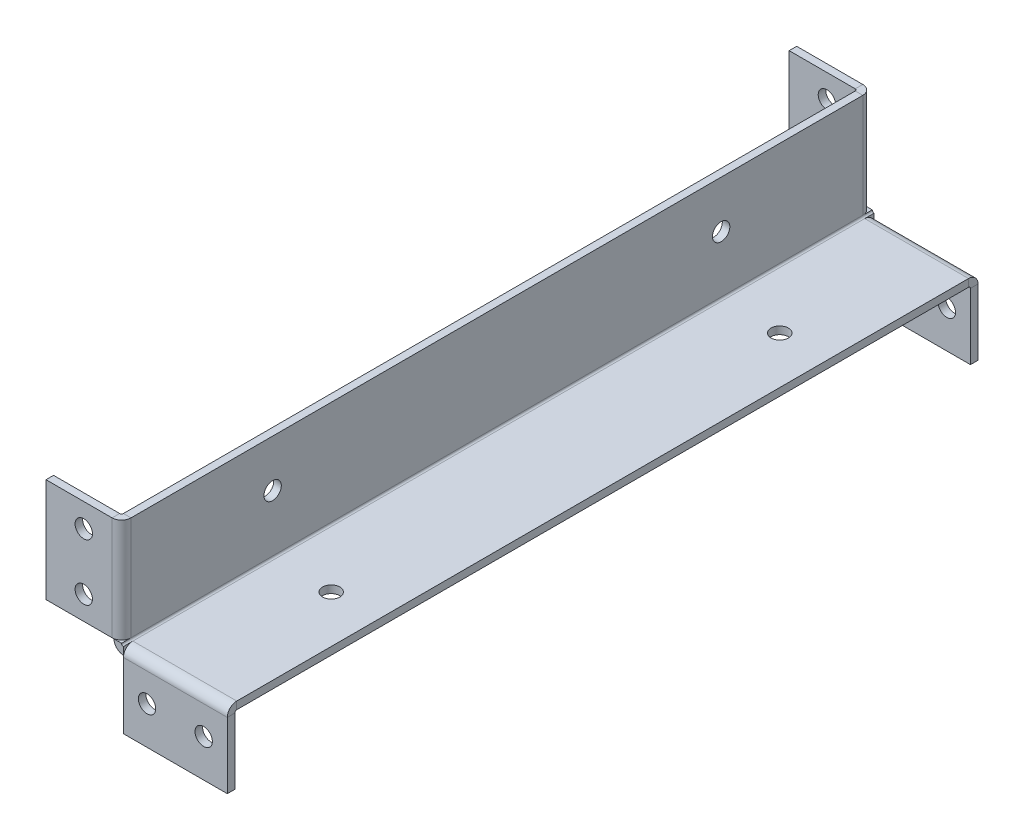
from build123d import *

# Parameters (mm, degrees)
SKETCH1_W                      = 60
SKETCH1_H                      = 397.5
BASE_FLANGE1_DEPTH             = 4
EDGE_FLANGE1_STRIP_W           = 18
EDGE_FLANGE1_STRIP_H           = 4
EDGE_FLANGE1_STRIP_CUT_DEPTH   = 397.5
EDGE_FLANGE1_DEPTH             = 397.5
EDGE_FLANGE2_STRIP_W           = 18
EDGE_FLANGE2_STRIP_H           = 4
EDGE_FLANGE2_STRIP_CUT_DEPTH   = 55
EDGE_FLANGE2_STRIP_2_W         = 18
EDGE_FLANGE2_STRIP_2_H         = 4
EDGE_FLANGE2_STRIP_CUT_2_DEPTH = 55
EDGE_FLANGE2_STRIP_3_W         = 18
EDGE_FLANGE2_STRIP_3_H         = 4
EDGE_FLANGE2_STRIP_CUT_3_DEPTH = 55
EDGE_FLANGE2_STRIP_4_W         = 18
EDGE_FLANGE2_STRIP_4_H         = 4
EDGE_FLANGE2_STRIP_CUT_4_DEPTH = 55
EDGE_FLANGE2_DEPTH             = 55
EDGE_FLANGE2_BEND_DEPTH        = 55
EDGE_FLANGE2_BEND_2_DEPTH      = 55
EDGE_FLANGE2_BEND_3_DEPTH      = 55
SKETCH18_R                     = 4.6
EXTRUDE1_DEPTH                 = 408.38464625
SKETCH19_R                     = 4.6
EXTRUDE2_DEPTH                 = 4
SKETCH20_R                     = 4.6
EXTRUDE3_DEPTH                 = 4


# Sheet-metal steps are written as plain solids
with BuildPart() as part:
    # Sketch1 → Base-Flange1 (new body)
    with BuildSketch(Plane(origin=(0, 0, 0), x_dir=(1, 0, 0), z_dir=(0, 1, 0))):
        Rectangle(SKETCH1_W, SKETCH1_H)
    extrude(amount=BASE_FLANGE1_DEPTH)

    # Edge-Flange1 strip (across the edge) → Edge-Flange1 strip cut (cut)
    with BuildSketch(Plane(origin=(-30, 4, -198.75), x_dir=(1, 0, 0), z_dir=(0, 0, 1))):
        with Locations((-4, -2)):
            Rectangle(EDGE_FLANGE1_STRIP_W, EDGE_FLANGE1_STRIP_H)
    extrude(amount=EDGE_FLANGE1_STRIP_CUT_DEPTH, mode=Mode.SUBTRACT)

    # Edge-Flange1 section (across the edge) → Edge-Flange1 (add)
    with BuildSketch(Plane(origin=(-30, 4, -198.75), x_dir=(1, 0, 0), z_dir=(0, 0, 1))):
        with BuildLine():
            Line((0, 1), (0, 56))
            Line((0, 56), (4, 56))
            Line((4, 56), (4, 1))
            ThreePointArc((4, 1), (4.292893219, 0.292893219), (5, 0))
            Line((5, 0), (5, -4))
            ThreePointArc((5, -4), (1.464466094, -2.535533906), (0, 1))
        make_face()
    extrude(amount=EDGE_FLANGE1_DEPTH)

    # Edge-Flange2 strip (across the edge) → Edge-Flange2 strip cut (cut)
    with BuildSketch(Plane(origin=(-30, 5, 198.75), x_dir=(0, 0, -1), z_dir=(0, 1, 0))):
        with Locations((-4, -2)):
            Rectangle(EDGE_FLANGE2_STRIP_W, EDGE_FLANGE2_STRIP_H)
    extrude(amount=EDGE_FLANGE2_STRIP_CUT_DEPTH, mode=Mode.SUBTRACT)

    # Edge-Flange2 strip 2 (across the edge) → Edge-Flange2 strip cut 2 (cut)
    with BuildSketch(Plane(origin=(30, 0, 198.75), x_dir=(0, 0, -1), z_dir=(-1, 0, 0))):
        with Locations((-4, -2)):
            Rectangle(EDGE_FLANGE2_STRIP_2_W, EDGE_FLANGE2_STRIP_2_H)
    extrude(amount=EDGE_FLANGE2_STRIP_CUT_2_DEPTH, mode=Mode.SUBTRACT)

    # Edge-Flange2 strip 3 (across the edge) → Edge-Flange2 strip cut 3 (cut)
    with BuildSketch(Plane(origin=(-30, 60, -198.75), x_dir=(0, 0, 1), z_dir=(0, -1, 0))):
        with Locations((-4, -2)):
            Rectangle(EDGE_FLANGE2_STRIP_3_W, EDGE_FLANGE2_STRIP_3_H)
    extrude(amount=EDGE_FLANGE2_STRIP_CUT_3_DEPTH, mode=Mode.SUBTRACT)

    # Edge-Flange2 strip 4 (across the edge) → Edge-Flange2 strip cut 4 (cut)
    with BuildSketch(Plane(origin=(-25, 0, -198.75), x_dir=(0, 0, 1), z_dir=(1, 0, 0))):
        with Locations((-4, -2)):
            Rectangle(EDGE_FLANGE2_STRIP_4_W, EDGE_FLANGE2_STRIP_4_H)
    extrude(amount=EDGE_FLANGE2_STRIP_CUT_4_DEPTH, mode=Mode.SUBTRACT)

    # Edge-Flange2 section (across the edge) → Edge-Flange2 (add)
    with BuildSketch(Plane(origin=(-30, 5, 198.75), x_dir=(0, 0, -1), z_dir=(0, 1, 0))):
        with BuildLine():
            Line((0, 1), (0, 36))
            Line((0, 36), (4, 36))
            Line((4, 36), (4, 1))
            ThreePointArc((4, 1), (4.292893219, 0.292893219), (5, 0))
            Line((5, 0), (5, -4))
            ThreePointArc((5, -4), (1.464466094, -2.535533906), (0, 1))
        make_face()
    extrude(amount=EDGE_FLANGE2_DEPTH)

    # Edge-Flange2 section 2 (across the edge) → Edge-Flange2 bend (add)
    with BuildSketch(Plane(origin=(30, 0, 198.75), x_dir=(0, 0, -1), z_dir=(-1, 0, 0))):
        with BuildLine():
            Line((0, 1), (0, 36))
            Line((0, 36), (4, 36))
            Line((4, 36), (4, 1))
            ThreePointArc((4, 1), (4.292893219, 0.292893219), (5, 0))
            Line((5, 0), (5, -4))
            ThreePointArc((5, -4), (1.464466094, -2.535533906), (0, 1))
        make_face()
    extrude(amount=EDGE_FLANGE2_BEND_DEPTH)

    # Edge-Flange2 section 3 (across the edge) → Edge-Flange2 bend 2 (add)
    with BuildSketch(Plane(origin=(-30, 60, -198.75), x_dir=(0, 0, 1), z_dir=(0, -1, 0))):
        with BuildLine():
            Line((0, 1), (0, 36))
            Line((0, 36), (4, 36))
            Line((4, 36), (4, 1))
            ThreePointArc((4, 1), (4.292893219, 0.292893219), (5, 0))
            Line((5, 0), (5, -4))
            ThreePointArc((5, -4), (1.464466094, -2.535533906), (0, 1))
        make_face()
    extrude(amount=EDGE_FLANGE2_BEND_2_DEPTH)

    # Edge-Flange2 section 4 (across the edge) → Edge-Flange2 bend 3 (add)
    with BuildSketch(Plane(origin=(-25, 0, -198.75), x_dir=(0, 0, 1), z_dir=(1, 0, 0))):
        with BuildLine():
            Line((0, 1), (0, 36))
            Line((0, 36), (4, 36))
            Line((4, 36), (4, 1))
            ThreePointArc((4, 1), (4.292893219, 0.292893219), (5, 0))
            Line((5, 0), (5, -4))
            ThreePointArc((5, -4), (1.464466094, -2.535533906), (0, 1))
        make_face()
    extrude(amount=EDGE_FLANGE2_BEND_3_DEPTH)

    # Sketch18 → Extrude1 (cut, through all)
    with BuildSketch(Plane.XY.offset(198.75)):
        with Locations((-46, 47.5)):
            Circle(SKETCH18_R)
        with Locations((-46, 17.5)):
            Circle(SKETCH18_R)
        with Locations((-12.5, -16)):
            Circle(SKETCH18_R)
        with Locations((17.5, -16)):
            Circle(SKETCH18_R)
    extrude(amount=-EXTRUDE1_DEPTH, mode=Mode.SUBTRACT)

    # Sketch19 → Extrude2 (cut)
    with BuildSketch(Plane(origin=(-26, 0, 0), x_dir=(0, 0, -1), z_dir=(1, 0, 0))):
        with Locations(Location((-118.75, 35, 0), (0, 0, 90))):
            Circle(SKETCH19_R)
        with Locations(Location((118.75, 35, 0), (0, 0, 90))):
            Circle(SKETCH19_R)
    extrude(amount=-EXTRUDE2_DEPTH, mode=Mode.SUBTRACT)

    # Sketch20 → Extrude3 (cut)
    with BuildSketch(Plane(origin=(0, 4, 0), x_dir=(1, 0, 0), z_dir=(0, 1, 0))):
        with Locations(Location((5, 118.75, 0), (0, 0, 270))):
            Circle(SKETCH20_R)
        with Locations(Location((5, -118.75, 0), (0, 0, 270))):
            Circle(SKETCH20_R)
    extrude(amount=-EXTRUDE3_DEPTH, mode=Mode.SUBTRACT)


solid = part.part
